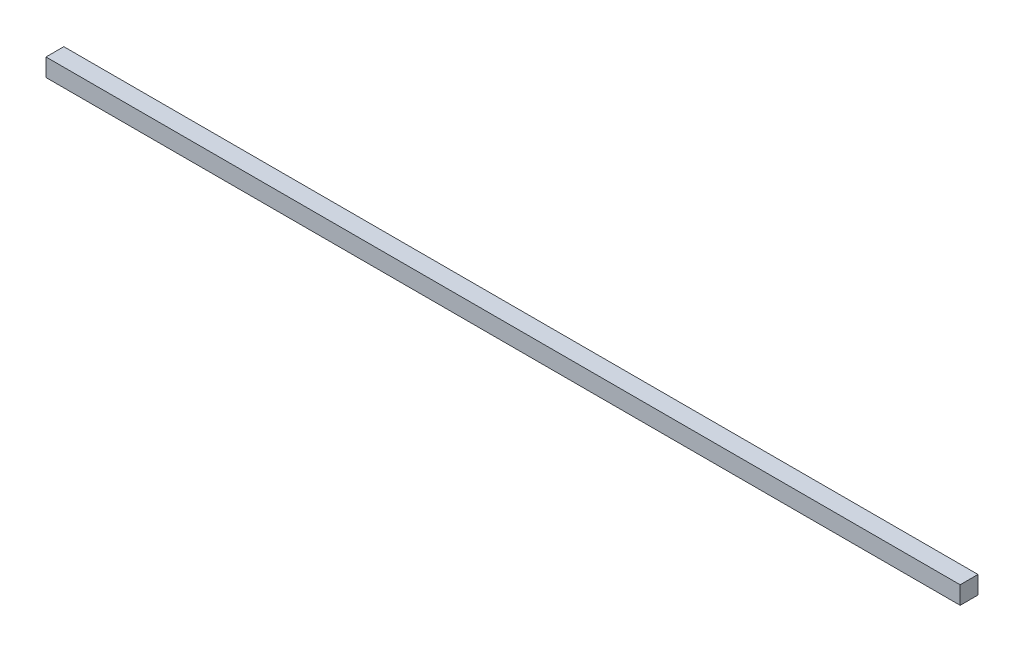
from build123d import *

# Parameters (mm, degrees)
SKETCH_1_W      = 6
SKETCH_1_H      = 6
EXTRUDE_1_DEPTH = 307.5


with BuildPart() as part:
    # Эскиз1 → Бобышка-Вытянуть1 (new body)
    with BuildSketch(Plane(origin=(0, 0, 0), x_dir=(0, 0, -1), z_dir=(1, 0, 0))):
        with Locations((3, 3)):
            Rectangle(SKETCH_1_W, SKETCH_1_H)
    extrude(amount=EXTRUDE_1_DEPTH)


solid = part.part
